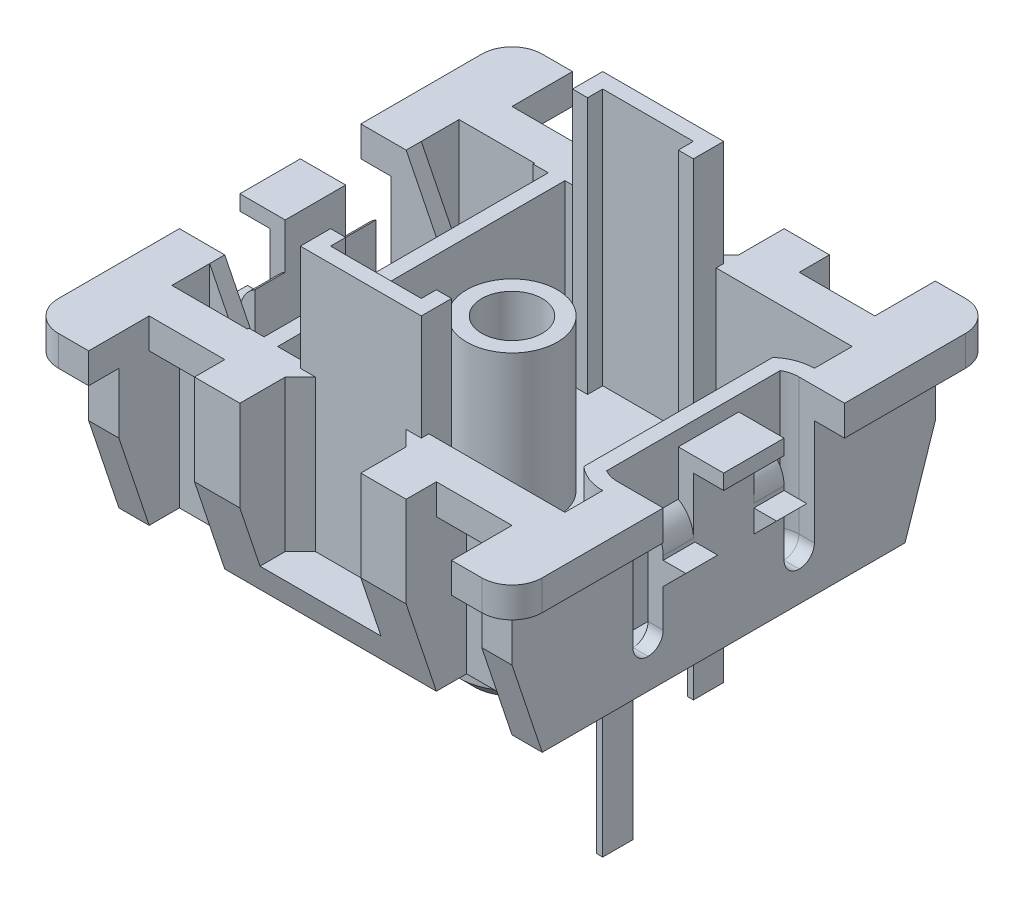
from build123d import *

# Parameters (mm, degrees)
BOSS_EXTRU_1_DEPTH            = 1
BOSS_EXTRU_3_DEPTH            = 5
ENL_V_MAT_EXTRU_1_DEPTH       = 18.720045147
ESQUISSE5_W                   = 2.5
ESQUISSE5_H                   = 6
ESQUISSE5_H_2                 = 1.25
ENL_V_MAT_EXTRU_12_DEPTH      = 5
ENL_V_MAT_EXTRU_17_DEPTH      = 5
ESQUISSE10_W                  = 3
ESQUISSE10_H                  = 1
ENL_V_MAT_EXTRU_20_DEPTH      = 5
ENL_V_MAT_EXTRU_21_DEPTH      = 5
ESQUISSE13_R                  = 1.75
BOSS_EXTRU_4_DEPTH            = 4
CHANFREIN1_SIZE               = 0.5
ESQUISSE14_R                  = 0.75
ENL_V_MAT_EXTRU_22_DEPTH      = 0.1
ESQUISSE15_R                  = 1.5
ESQUISSE15_R_2                = 1
BOSS_EXTRU_5_DEPTH            = 5
ENL_V_START                   = -4
ESQUISSE16_R                  = 1
ENL_V_MAT_EXTRU_23_DEPTH      = 4
ESQUISSE17_W                  = 0.2
ESQUISSE17_H                  = 1
BOSS_EXTRU_6_DEPTH            = 5
ENL_V_MAT_EXTRU_24_DEPTH      = 1.2
ENL_V_MAT_EXTRU_24_DEPTH_BACK = 8.2
BOSS_EXTRU_7_DEPTH            = 3.5
ESQUISSE20_W                  = 0.5
ESQUISSE20_H                  = 1
ENL_V_MAT_EXTRU_25_DEPTH      = 1.5
ESQUISSE22_W                  = 1
ESQUISSE22_H                  = 0.75
BOSS_EXTRU_8_DEPTH            = 0.75
CHANFREIN2_SIZE               = 0.75
CONG_1_START                  = -2
CONG_1_DEPTH                  = 1
CONG_1_START_2                = 1
CONG_1_2_DEPTH                = 1
ESQUISSE23_W                  = 1
ESQUISSE23_H                  = 2
ENL_V_MAT_EXTRU_26_DEPTH      = 0.5
ESQUISSE24_W                  = 1.050228153
ESQUISSE24_H                  = 0.75
ESQUISSE24_W_2                = 1
BOSS_EXTRU_9_DEPTH            = 0.75
CHANFREIN3_SIZE               = 0.75
CONG_2_R                      = 1
ESQUISSE25_W                  = 1
ESQUISSE25_H                  = 2
ENL_V_MAT_EXTRU_27_DEPTH      = 0.5
CONG_3_R                      = 0.5


with BuildPart() as part:
    # Esquisse1 → Boss.-Extru.1 (new body)
    with BuildSketch(Plane(origin=(0, 0, 0), x_dir=(1, 0, 0), z_dir=(0, 1, 0))):
        with BuildLine():
            Line((-6, 6), (-6, 8))
            Line((-6, 8), (-7, 8))
            ThreePointArc((-7, 8), (-7.707106781, 7.707106781), (-8, 7))
            Line((-8, 7), (-8, 3))
            Line((-8, 3), (-7, 3))
            Line((-7, 3), (-7, 1))
            Line((-7, 1), (-8, 1))
            Line((-8, 1), (-8, 0))
            Line((-8, 0), (0, 0))
            Line((0, 0), (0, 6.5))
            Line((0, 6.5), (-2, 6.5))
            Line((-2, 6.5), (-2, 7))
            Line((-2, 7), (-3.5, 7))
            Line((-3.5, 7), (-3.5, 6))
            Line((-3.5, 6), (-6, 6))
        make_face()
        with BuildLine():
            Line((7, 8), (6, 8))
            Line((6, 8), (6, 6))
            Line((6, 6), (3.5, 6))
            Line((3.5, 6), (3.5, 7))
            Line((3.5, 7), (2, 7))
            Line((2, 7), (2, 6.5))
            Line((2, 6.5), (0, 6.5))
            Line((0, 6.5), (0, 0))
            Line((0, 0), (8, 0))
            Line((8, 0), (8, 1))
            Line((8, 1), (7, 1))
            Line((7, 1), (7, 3))
            Line((7, 3), (8, 3))
            Line((8, 3), (8, 7))
            ThreePointArc((8, 7), (7.707106781, 7.707106781), (7, 8))
        make_face()
        with BuildLine():
            Line((0, 0), (-8, 0))
            Line((-8, 0), (-8, -1))
            Line((-8, -1), (-7, -1))
            Line((-7, -1), (-7, -3))
            Line((-7, -3), (-8, -3))
            Line((-8, -3), (-8, -7))
            ThreePointArc((-8, -7), (-7.707106781, -7.707106781), (-7, -8))
            Line((-7, -8), (-6, -8))
            Line((-6, -8), (-6, -6))
            Line((-6, -6), (-3.5, -6))
            Line((-3.5, -6), (-3.5, -7))
            Line((-3.5, -7), (-2, -7))
            Line((-2, -7), (-2, -6.5))
            Line((-2, -6.5), (0, -6.5))
            Line((0, -6.5), (0, 0))
        make_face()
        with BuildLine():
            Line((8, -1), (8, 0))
            Line((8, 0), (0, 0))
            Line((0, 0), (0, -6.5))
            Line((0, -6.5), (2, -6.5))
            Line((2, -6.5), (2, -7))
            Line((2, -7), (3.5, -7))
            Line((3.5, -7), (3.5, -6))
            Line((3.5, -6), (6, -6))
            Line((6, -6), (6, -8))
            Line((6, -8), (7, -8))
            ThreePointArc((7, -8), (7.707106781, -7.707106781), (8, -7))
            Line((8, -7), (8, -3))
            Line((8, -3), (7, -3))
            Line((7, -3), (7, -1))
            Line((7, -1), (8, -1))
        make_face()
    extrude(amount=BOSS_EXTRU_1_DEPTH)

    # Esquisse2 → Boss.-Extru.3 (add)
    with BuildSketch(Plane.XZ):
        Polygon((7, 7), (6, 7), (6, 6), (6, 5), (3.5, 5), (3.5, 6), (3.5, 7), (2, 7), (2, 6.5), (-2, 6.5), (-2, 7), (-3.5, 7), (-3.5, 6), (-3.5, 5), (-6, 5), (-6, 6), (-6, 7), (-7, 7), (-7, 3), (-7, 1), (-7, 0), (7, 0), (7, 1), (7, 3), align=None)
        Polygon((7, -1), (7, 0), (-7, 0), (-7, -1), (-7, -3), (-7, -7), (-6, -7), (-6, -6), (-6, -5), (-3.5, -5), (-3.5, -6), (-3.5, -7), (-2, -7), (-2, -6.5), (2, -6.5), (2, -7), (3.5, -7), (3.5, -6), (3.5, -5), (6, -5), (6, -6), (6, -7), (7, -7), (7, -3), align=None)
    extrude(amount=BOSS_EXTRU_3_DEPTH)

    # Esquisse3 → Enlèv. mat.-Extru.1 (cut, through all)
    with BuildSketch(Plane(origin=(7, 0, 0), x_dir=(0, 0, -1), z_dir=(1, 0, 0))):
        Polygon((-6, -5), (-7, -2), (-7, -5), align=None)
        Polygon((7, -2), (6, -5), (7, -5), align=None)
    extrude(amount=-ENL_V_MAT_EXTRU_1_DEPTH, mode=Mode.SUBTRACT)

    # Esquisse5 → Enlèv. mat.-Extru.12 (cut)
    with BuildSketch(Plane(origin=(0, 1, 0), x_dir=(1, 0, 0), z_dir=(0, 1, 0))):
        with BuildLine():
            ThreePointArc((5.5, 3.123552873), (5.960421762, 3.402712063), (6.49, 3.5))
            Line((6.49, 3.5), (6.5, 3.5))
            Line((6.5, 3.5), (6.5, 4.75))
            Line((6.5, 4.75), (2, 4.75))
            Line((2, 4.75), (2, 4))
            Line((2, 4), (1.5, 4))
            Line((1.5, 4), (1.5, 4.5))
            Line((1.5, 4.5), (-1.5, 4.5))
            Line((-1.5, 4.5), (-1.5, 4))
            Line((-1.5, 4), (-2, 4))
            Line((-2, 4), (-2, 4.75))
            Line((-2, 4.75), (-3, 4.75))
            Line((-3, 4.75), (-3, -4.75))
            Line((-3, -4.75), (-2, -4.75))
            Line((-2, -4.75), (-2, -4))
            Line((-2, -4), (-1.5, -4))
            Line((-1.5, -4), (-1.5, -4.5))
            Line((-1.5, -4.5), (1.5, -4.5))
            Line((1.5, -4.5), (1.5, -4))
            Line((1.5, -4), (2, -4))
            Line((2, -4), (2, -4.75))
            Line((2, -4.75), (6.5, -4.75))
            Line((6.5, -4.75), (6.5, -3.5))
            Line((6.5, -3.5), (6.49, -3.5))
            ThreePointArc((6.49, -3.5), (5.960421762, -3.402712063), (5.5, -3.123552873))
            Line((5.5, -3.123552873), (5.5, 3.123552873))
        make_face()
        with Locations((-5.25, 0)):
            Rectangle(ESQUISSE5_W, ESQUISSE5_H)
        with Locations((-5.25, 4.125)):
            Rectangle(ESQUISSE5_W, ESQUISSE5_H_2)
        with Locations((-5.25, -4.125)):
            Rectangle(ESQUISSE5_W, ESQUISSE5_H_2)
    extrude(amount=-ENL_V_MAT_EXTRU_12_DEPTH, mode=Mode.SUBTRACT)

    # Esquisse8 → Enlèv. mat.-Extru.17 (cut)
    with BuildSketch(Plane(origin=(0, 1, -1), x_dir=(1, 0, 0), z_dir=(0, -1, 0))):
        Polygon((1.5, -4), (-1.5, -4), (-2, -4.5), (-2, -5.5), (2, -5.5), (2, -4.5), align=None)
        Polygon((-2, 6.5), (-1.5, 6), (1.5, 6), (2, 6.5), (2, 7.5), (-2, 7.5), align=None)
    extrude(amount=ENL_V_MAT_EXTRU_17_DEPTH, mode=Mode.SUBTRACT)

    # Esquisse10 → Enlèv. mat.-Extru.20 (cut)
    with BuildSketch(Plane(origin=(0, 1, 0), x_dir=(1, 0, 0), z_dir=(0, 1, 0))):
        with Locations((-6.5, 2.5)):
            Rectangle(ESQUISSE10_W, ESQUISSE10_H)
        with Locations((-6.5, -2.5)):
            Rectangle(ESQUISSE10_W, ESQUISSE10_H)
    extrude(amount=-ENL_V_MAT_EXTRU_20_DEPTH, mode=Mode.SUBTRACT)

    # Esquisse12 → Enlèv. mat.-Extru.21 (cut)
    with BuildSketch(Plane(origin=(0, 1, 0), x_dir=(1, 0, 0), z_dir=(0, 1, 0))):
        with BuildLine():
            Line((6.49, -3), (7, -3))
            Line((7, -3), (7, -2))
            Line((7, -2), (6.5, -2))
            Line((6.5, -2), (6.5, 2))
            Line((6.5, 2), (7, 2))
            Line((7, 2), (7, 3))
            Line((7, 3), (6.49, 3))
            ThreePointArc((6.49, 3), (6.236553952, 2.967008412), (6, 2.870232527))
            Line((6, 2.870232527), (6, -2.870232527))
            ThreePointArc((6, -2.870232527), (6.236553952, -2.967008412), (6.49, -3))
        make_face()
    extrude(amount=-ENL_V_MAT_EXTRU_21_DEPTH, mode=Mode.SUBTRACT)

    # Esquisse13 → Boss.-Extru.4 (add)
    with BuildSketch(Plane.XZ.offset(5)):
        with Locations(Location((0, 0, 0), (0, 0, 270))):
            Circle(ESQUISSE13_R)
    extrude(amount=BOSS_EXTRU_4_DEPTH)

    # Chanfrein1
    chanfrein1_edges = [part.edges().sort_by_distance(p)[0] for p in [
        (0, -9, 1.75),
    ]]
    chamfer(chanfrein1_edges, length=CHANFREIN1_SIZE)

    # Esquisse14 → Enlèv. mat.-Extru.22 (cut)
    with BuildSketch(Plane.XZ.offset(9)):
        with Locations(Location((0, 0, 0), (0, 0, 270))):
            Circle(ESQUISSE14_R)
    extrude(amount=-ENL_V_MAT_EXTRU_22_DEPTH, mode=Mode.SUBTRACT)

    # Esquisse15 → Boss.-Extru.5 (add)
    with BuildSketch(Plane(origin=(0, -4, 0), x_dir=(1, 0, 0), z_dir=(0, 1, 0))):
        with Locations(Location((0, 0, 0), (0, 0, 270))):
            Circle(ESQUISSE15_R)
        with Locations(Location((0, 0, 0), (0, 0, 270))):
            Circle(ESQUISSE15_R_2, mode=Mode.SUBTRACT)
    extrude(amount=BOSS_EXTRU_5_DEPTH)

    # Esquisse16 → Enlèv. mat.-Extru.23 (cut)
    with BuildSketch(Plane(origin=(0, -4, 0), x_dir=(1, 0, 0), z_dir=(0, 1, 0)).offset(ENL_V_START)):
        with Locations(Location((0, 0, 0), (0, 0, 270))):
            Circle(ESQUISSE16_R)
    extrude(amount=ENL_V_MAT_EXTRU_23_DEPTH, mode=Mode.SUBTRACT)

    # Esquisse17 → Boss.-Extru.6 (add)
    with BuildSketch(Plane.XZ.offset(5)):
        with Locations((2.9, -3.5)):
            Rectangle(ESQUISSE17_W, ESQUISSE17_H)
        with Locations((5.9, 2.5)):
            Rectangle(ESQUISSE17_W, ESQUISSE17_H)
    extrude(amount=BOSS_EXTRU_6_DEPTH)

    # Esquisse18 → Enlèv. mat.-Extru.24 (cut, two sides: drawn at the far end of the back side and taken through both)
    with BuildSketch(Plane.XY.offset(3.5).offset(-ENL_V_MAT_EXTRU_24_DEPTH_BACK)):
        Polygon((-4, 1), (-6.5, 1), (-5.5, -1), (-4.5, -1), (-4, 0), align=None)
        Polygon((-3.5, 1), (-4, 1), (-4, 0), align=None)
    extrude(amount=ENL_V_MAT_EXTRU_24_DEPTH + ENL_V_MAT_EXTRU_24_DEPTH_BACK, mode=Mode.SUBTRACT)

    # Esquisse19 → Boss.-Extru.7 (add)
    with BuildSketch(Plane(origin=(0, 1, 0), x_dir=(1, 0, 0), z_dir=(0, 1, 0))):
        Polygon((1.5, 4), (2, 4), (2, 5), (-2, 5), (-2, 4), (-1.5, 4), (-1.5, 4.5), (1.5, 4.5), align=None)
        Polygon((2, -5), (2, -4), (1.5, -4), (1.5, -4.5), (-1.5, -4.5), (-1.5, -4), (-2, -4), (-2, -5), align=None)
    extrude(amount=BOSS_EXTRU_7_DEPTH)

    # Esquisse20 → Enlèv. mat.-Extru.25 (cut)
    with BuildSketch(Plane(origin=(0, 1, 0), x_dir=(1, 0, 0), z_dir=(0, 1, 0))):
        with Locations((-6.75, 1.5)):
            Rectangle(ESQUISSE20_W, ESQUISSE20_H)
        with Locations((-6.75, -1.5)):
            Rectangle(ESQUISSE20_W, ESQUISSE20_H)
        with Locations((6.75, 1.5)):
            Rectangle(ESQUISSE20_W, ESQUISSE20_H)
        with Locations((6.75, -1.5)):
            Rectangle(ESQUISSE20_W, ESQUISSE20_H)
    extrude(amount=-ENL_V_MAT_EXTRU_25_DEPTH, mode=Mode.SUBTRACT)

    # Esquisse22 → Boss.-Extru.8 (add)
    with BuildSketch(Plane.ZY.offset(7)):
        with Locations((-1.5, -1.875)):
            Rectangle(ESQUISSE22_W, ESQUISSE22_H)
        with Locations((1.5, -1.875)):
            Rectangle(ESQUISSE22_W, ESQUISSE22_H)
    extrude(amount=BOSS_EXTRU_8_DEPTH)

    # Chanfrein2
    chanfrein2_edges = [part.edges().sort_by_distance(p)[0] for p in [
        (-7.75, -2.25, 1.5),
        (-7.75, -2.25, -1.5),
    ]]
    chamfer(chanfrein2_edges, length=CHANFREIN2_SIZE - 0.0001)  # a hair under: the kernel refuses the full size

    # Congé1: read off the stored shape, not the designer's step
    # Congé1 outline → Congé1 (cut)
    with BuildSketch(Plane.XY.offset(CONG_1_START)):
        with BuildLine():
            add(Edge.make_bspline(
                [(-6.5, -0.5), (-7, -0.788675135), (-7, -1.366025404)],
                knots=[0, 0, 0, 1, 1, 1], degree=2, weights=[1, 0.866025404, 1]))
            Line((-6.5, -0.5), (-7, -0.5))
            Line((-7, -0.5), (-7, -1.366025404))
        make_face()
    extrude(amount=CONG_1_DEPTH, mode=Mode.SUBTRACT)

    # Cong_1 2 outline → Cong_1 2 (cut)
    with BuildSketch(Plane.XY.offset(CONG_1_START_2)):
        with BuildLine():
            add(Edge.make_bspline(
                [(-6.5, -0.5), (-7, -0.788675135), (-7, -1.366025404)],
                knots=[0, 0, 0, 1, 1, 1], degree=2, weights=[1, 0.866025404, 1]))
            Line((-6.5, -0.5), (-7, -0.5))
            Line((-7, -0.5), (-7, -1.366025404))
        make_face()
    extrude(amount=CONG_1_2_DEPTH, mode=Mode.SUBTRACT)

    # Esquisse23 → Enlèv. mat.-Extru.26 (cut)
    with BuildSketch(Plane.XZ):
        with Locations((-7.5, 0)):
            Rectangle(ESQUISSE23_W, ESQUISSE23_H)
    extrude(amount=-ENL_V_MAT_EXTRU_26_DEPTH, mode=Mode.SUBTRACT)

    # Esquisse24 → Boss.-Extru.9 (add)
    with BuildSketch(Plane(origin=(7, 0, 0), x_dir=(0, 0, -1), z_dir=(1, 0, 0))):
        with Locations((-1.474885924, -1.875)):
            Rectangle(ESQUISSE24_W, ESQUISSE24_H)
        with Locations((1.5, -1.875)):
            Rectangle(ESQUISSE24_W_2, ESQUISSE24_H)
    extrude(amount=BOSS_EXTRU_9_DEPTH)

    # Chanfrein3
    chanfrein3_edges = [part.edges().sort_by_distance(p)[0] for p in [
        (7.75, -2.25, 1.474885924),
        (7.75, -2.25, -1.5),
    ]]
    chamfer(chanfrein3_edges, length=CHANFREIN3_SIZE - 0.0001)  # a hair under: the kernel refuses the full size

    # Congé2
    # the kernel refuses this fillet: 1 mm, written as the material it takes off along each edge
    with BuildSketch(Plane(origin=(7, -0.5, -4.165063509), x_dir=(0, -1, 0), z_dir=(0, 0, 1))) as cong_2_piece_1_section:
        with BuildLine():
            CenterArc((0.866025404, -1), CONG_2_R, 90, 60)
            Line((0, -0.5), (0, 0))
            Line((0, 0), (0.866025404, 0))
        make_face()
    cong_2_piece_1 = extrude(amount=3.165063509, mode=Mode.PRIVATE)
    cong_2_piece_1 = split(cong_2_piece_1, bisect_by=Plane(origin=(7, -0.5, -3), z_dir=(0, 0, 1)), keep=Keep.TOP, mode=Mode.PRIVATE)
    add(cong_2_piece_1, mode=Mode.SUBTRACT)
    with BuildSketch(Plane(origin=(7, -0.5, -4.165063509), x_dir=(0, -1, 0), z_dir=(0, 0, 1))) as cong_2_piece_2_section:
        with BuildLine():
            CenterArc((0.866025404, -1), CONG_2_R, 90, 60)
            Line((0, -0.5), (0, 0))
            Line((0, 0), (0.866025404, 0))
        make_face()
    cong_2_piece_2 = extrude(amount=5.330127019, mode=Mode.PRIVATE)
    cong_2_piece_2 = split(cong_2_piece_2, bisect_by=Plane(origin=(7, -0.5, 1), z_dir=(0, 0, 1)), keep=Keep.TOP, mode=Mode.PRIVATE)
    add(cong_2_piece_2, mode=Mode.SUBTRACT)
    with BuildSketch(Plane(origin=(7, -0.5, -1.165063509), x_dir=(0, -1, 0), z_dir=(0, 0, 1))) as cong_2_piece_3_section:
        with BuildLine():
            CenterArc((0.866025404, -1), CONG_2_R, 90, 60)
            Line((0, -0.5), (0, 0))
            Line((0, 0), (0.866025404, 0))
        make_face()
    cong_2_piece_3 = extrude(amount=5.330127019, mode=Mode.PRIVATE)
    cong_2_piece_3 = split(cong_2_piece_3, bisect_by=Plane(origin=(7, -0.5, -1), z_dir=(0, 0, -1)), keep=Keep.TOP, mode=Mode.PRIVATE)
    add(cong_2_piece_3, mode=Mode.SUBTRACT)
    with BuildSketch(Plane(origin=(7, -0.5, 1), x_dir=(0, -1, 0), z_dir=(0, 0, 1))) as cong_2_piece_4_section:
        with BuildLine():
            CenterArc((0.866025404, -1), CONG_2_R, 90, 60)
            Line((0, -0.5), (0, 0))
            Line((0, 0), (0.866025404, 0))
        make_face()
    cong_2_piece_4 = extrude(amount=3.165063509, mode=Mode.PRIVATE)
    cong_2_piece_4 = split(cong_2_piece_4, bisect_by=Plane(origin=(7, -0.5, 3), z_dir=(0, 0, -1)), keep=Keep.TOP, mode=Mode.PRIVATE)
    add(cong_2_piece_4, mode=Mode.SUBTRACT)

    # Esquisse25 → Enlèv. mat.-Extru.27 (cut)
    with BuildSketch(Plane.XZ):
        with Locations((7.5, 0)):
            Rectangle(ESQUISSE25_W, ESQUISSE25_H)
    extrude(amount=-ENL_V_MAT_EXTRU_27_DEPTH, mode=Mode.SUBTRACT)

    # Congé3
    cong_3_edges = [part.edges().sort_by_distance(p)[0] for p in [
        (6.236553952, -4, 2.967008412),
        (6.236553952, -4, -2.967008412),
        (-6.75, -4, -2),
        (-5.5, -4, -3),
        (-5.5, -4, 3),
        (-6.75, -4, 2),
        (6.75, -4, 2),
        (6.745, -4, 3),
        (6.745, -4, -3),
        (6.75, -4, -2),
    ]]
    fillet(cong_3_edges, radius=CONG_3_R - 0.0001)  # a hair under: the kernel refuses the full size


solid = part.part
